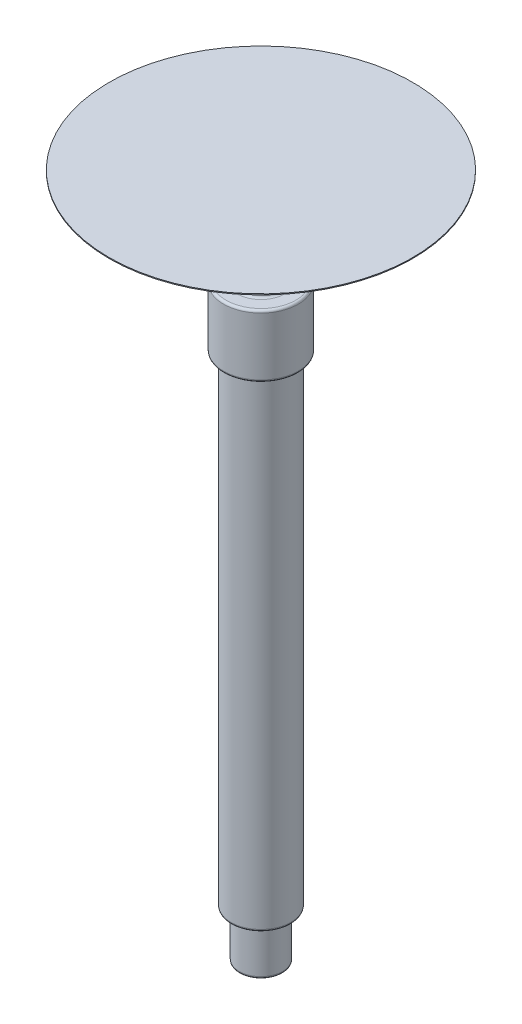
from build123d import *

# Parameters (mm, degrees)
ADAFRUIT_ALUMINUM_GT2_TIMING_PULLEY_6M_DEPTH = 7.4
BOSS_EXTRUDE7_START                          = -7.4
SKETCH3_2_R                                  = 8
BOSS_EXTRUDE7_DEPTH                          = 3
BOSS_EXTRUDE5_START                          = 3
SKETCH3_R                                    = 8
BOSS_EXTRUDE5_DEPTH                          = 3
SKETCH5_R                                    = 4.65
BOSS_EXTRUDE9_DEPTH                          = 7
BOSS_EXTRUDE10_START                         = 23.4
SKETCH3_4_R                                  = 8
BOSS_EXTRUDE10_DEPTH                         = 13.4
SKETCH1_R                                    = 6.425
BOSS_EXTRUDE1_DEPTH                          = 103
SKETCH4_R                                    = 4.65
BOSS_EXTRUDE6_DEPTH                          = 10
FILLET1_R                                    = 0.5
SKETCH6_R                                    = 32.5
BOSS_EXTRUDE11_DEPTH                         = 0.2


# Read off the part's stored shape, not the designer's step: Adafruit Aluminum GT2 Timing Pulley - 6mm Belt - 20 Tooth - 5mm Bore (Teeth Only)
with BuildPart() as part:
    # Adafruit Aluminum GT2 Timing Pulley  2 → Adafruit Aluminum GT2 Timing Pulley - 6m (new body)
    with BuildSketch(Plane(origin=(0, 0, 0), x_dir=(1, 0, 0), z_dir=(0, 1, 0))):
        with BuildLine():
            ThreePointArc((-4.171664646, 4.450529641), (-4.313351365, 4.313351365), (-4.450529641, 4.171664646))
            ThreePointArc((-4.450529641, 4.171664646), (-4.491023732, 4.064611454), (-4.444222249, 3.960161568))
            ThreePointArc((-4.444222249, 3.960161568), (-4.336160317, 3.839832706), (-4.248908631, 3.703657967))
            ThreePointArc((-4.248908631, 3.703657967), (-4.289891144, 3.116788357), (-4.835373018, 2.896458988))
            ThreePointArc((-4.835373018, 2.896458988), (-4.991845144, 2.937359964), (-5.139677666, 3.002949305))
            ThreePointArc((-5.139677666, 3.002949305), (-5.253477864, 3.01518337), (-5.342778138, 2.943589946))
            ThreePointArc((-5.342778138, 2.943589946), (-5.435139798, 2.769342049), (-5.521820486, 2.592199552))
            ThreePointArc((-5.521820486, 2.592199552), (-5.527251399, 2.477872554), (-5.450463754, 2.392997263))
            ThreePointArc((-5.450463754, 2.392997263), (-5.310507087, 2.311950687), (-5.185445494, 2.209403069))
            ThreePointArc((-5.185445494, 2.209403069), (-5.043069496, 1.638592609), (-5.493768068, 1.260483758))
            ThreePointArc((-5.493768068, 1.260483758), (-5.655221, 1.251030352), (-5.816086304, 1.26772676))
            ThreePointArc((-5.816086304, 1.26772676), (-5.928097258, 1.244195853), (-5.990903281, 1.148511157))
            ThreePointArc((-5.990903281, 1.148511157), (-6.024898878, 0.954250236), (-6.05259707, 0.758991905))
            ThreePointArc((-6.05259707, 0.758991905), (-6.02243319, 0.648582224), (-5.923175892, 0.591589713))
            ThreePointArc((-5.923175892, 0.591589713), (-5.765024422, 0.557758828), (-5.614394822, 0.498876404))
            ThreePointArc((-5.614394822, 0.498876404), (-5.30259707, 0), (-5.614394822, -0.498876404))
            ThreePointArc((-5.614394822, -0.498876404), (-5.765024422, -0.557758828), (-5.923175892, -0.591589713))
            ThreePointArc((-5.923175892, -0.591589713), (-6.02243319, -0.648582224), (-6.05259707, -0.758991905))
            ThreePointArc((-6.05259707, -0.758991905), (-6.024898878, -0.954250236), (-5.990903281, -1.148511157))
            ThreePointArc((-5.990903281, -1.148511157), (-5.928097258, -1.244195853), (-5.816086304, -1.26772676))
            ThreePointArc((-5.816086304, -1.26772676), (-5.655221, -1.251030352), (-5.493768068, -1.260483758))
            ThreePointArc((-5.493768068, -1.260483758), (-5.043069496, -1.638592609), (-5.185445494, -2.209403069))
            ThreePointArc((-5.185445494, -2.209403069), (-5.310507087, -2.311950687), (-5.450463754, -2.392997263))
            ThreePointArc((-5.450463754, -2.392997263), (-5.527251399, -2.477872554), (-5.521820486, -2.592199552))
            ThreePointArc((-5.521820486, -2.592199552), (-5.435139798, -2.769342049), (-5.342778138, -2.943589946))
            ThreePointArc((-5.342778138, -2.943589946), (-5.253477864, -3.01518337), (-5.139677666, -3.002949305))
            ThreePointArc((-5.139677666, -3.002949305), (-4.991845144, -2.937359964), (-4.835373018, -2.896458988))
            ThreePointArc((-4.835373018, -2.896458988), (-4.289891144, -3.116788357), (-4.248908631, -3.703657967))
            ThreePointArc((-4.248908631, -3.703657967), (-4.336160317, -3.839832706), (-4.444222249, -3.960161568))
            ThreePointArc((-4.444222249, -3.960161568), (-4.491023732, -4.064611454), (-4.450529641, -4.171664646))
            ThreePointArc((-4.450529641, -4.171664646), (-4.313351365, -4.313351365), (-4.171664646, -4.450529641))
            ThreePointArc((-4.171664646, -4.450529641), (-4.064611454, -4.491023732), (-3.960161568, -4.444222249))
            ThreePointArc((-3.960161568, -4.444222249), (-3.839832706, -4.336160317), (-3.703657967, -4.248908631))
            ThreePointArc((-3.703657967, -4.248908631), (-3.116788357, -4.289891144), (-2.896458988, -4.835373018))
            ThreePointArc((-2.896458988, -4.835373018), (-2.937359964, -4.991845144), (-3.002949305, -5.139677666))
            ThreePointArc((-3.002949305, -5.139677666), (-3.01518337, -5.253477864), (-2.943589946, -5.342778138))
            ThreePointArc((-2.943589946, -5.342778138), (-2.769342049, -5.435139798), (-2.592199552, -5.521820486))
            ThreePointArc((-2.592199552, -5.521820486), (-2.477872554, -5.527251399), (-2.392997263, -5.450463754))
            ThreePointArc((-2.392997263, -5.450463754), (-2.311950687, -5.310507087), (-2.209403069, -5.185445494))
            ThreePointArc((-2.209403069, -5.185445494), (-1.638592609, -5.043069496), (-1.260483758, -5.493768068))
            ThreePointArc((-1.260483758, -5.493768068), (-1.251030352, -5.655221), (-1.26772676, -5.816086304))
            ThreePointArc((-1.26772676, -5.816086304), (-1.244195853, -5.928097258), (-1.148511157, -5.990903281))
            ThreePointArc((-1.148511157, -5.990903281), (-0.954250236, -6.024898878), (-0.758991905, -6.05259707))
            ThreePointArc((-0.758991905, -6.05259707), (-0.648582224, -6.02243319), (-0.591589713, -5.923175892))
            ThreePointArc((-0.591589713, -5.923175892), (-0.557758828, -5.765024422), (-0.498876404, -5.614394822))
            ThreePointArc((-0.498876404, -5.614394822), (0, -5.30259707), (0.498876404, -5.614394822))
            ThreePointArc((0.498876404, -5.614394822), (0.557758828, -5.765024422), (0.591589713, -5.923175892))
            ThreePointArc((0.591589713, -5.923175892), (0.648582224, -6.02243319), (0.758991905, -6.05259707))
            ThreePointArc((0.758991905, -6.05259707), (0.954250236, -6.024898878), (1.148511157, -5.990903281))
            ThreePointArc((1.148511157, -5.990903281), (1.244195853, -5.928097258), (1.26772676, -5.816086304))
            ThreePointArc((1.26772676, -5.816086304), (1.251030352, -5.655221), (1.260483758, -5.493768068))
            ThreePointArc((1.260483758, -5.493768068), (1.638592609, -5.043069496), (2.209403069, -5.185445494))
            ThreePointArc((2.209403069, -5.185445494), (2.311950687, -5.310507087), (2.392997263, -5.450463754))
            ThreePointArc((2.392997263, -5.450463754), (2.477872554, -5.527251399), (2.592199552, -5.521820486))
            ThreePointArc((2.592199552, -5.521820486), (2.769342049, -5.435139798), (2.943589946, -5.342778138))
            ThreePointArc((2.943589946, -5.342778138), (3.01518337, -5.253477864), (3.002949305, -5.139677666))
            ThreePointArc((3.002949305, -5.139677666), (2.937359964, -4.991845144), (2.896458988, -4.835373018))
            ThreePointArc((2.896458988, -4.835373018), (3.116788357, -4.289891144), (3.703657967, -4.248908631))
            ThreePointArc((3.703657967, -4.248908631), (3.839832706, -4.336160317), (3.960161568, -4.444222249))
            ThreePointArc((3.960161568, -4.444222249), (4.064611454, -4.491023732), (4.171664646, -4.450529641))
            ThreePointArc((4.171664646, -4.450529641), (4.313351365, -4.313351365), (4.450529641, -4.171664646))
            ThreePointArc((4.450529641, -4.171664646), (4.491023732, -4.064611454), (4.444222249, -3.960161568))
            ThreePointArc((4.444222249, -3.960161568), (4.336160317, -3.839832706), (4.248908631, -3.703657967))
            ThreePointArc((4.248908631, -3.703657967), (4.289891144, -3.116788357), (4.835373018, -2.896458988))
            ThreePointArc((4.835373018, -2.896458988), (4.991845144, -2.937359964), (5.139677666, -3.002949305))
            ThreePointArc((5.139677666, -3.002949305), (5.253477864, -3.01518337), (5.342778138, -2.943589946))
            ThreePointArc((5.342778138, -2.943589946), (5.435139798, -2.769342049), (5.521820486, -2.592199552))
            ThreePointArc((5.521820486, -2.592199552), (5.527251399, -2.477872554), (5.450463754, -2.392997263))
            ThreePointArc((5.450463754, -2.392997263), (5.310507087, -2.311950687), (5.185445494, -2.209403069))
            ThreePointArc((5.185445494, -2.209403069), (5.043069496, -1.638592609), (5.493768068, -1.260483758))
            ThreePointArc((5.493768068, -1.260483758), (5.655221, -1.251030352), (5.816086304, -1.26772676))
            ThreePointArc((5.816086304, -1.26772676), (5.928097258, -1.244195853), (5.990903281, -1.148511157))
            ThreePointArc((5.990903281, -1.148511157), (6.024898878, -0.954250236), (6.05259707, -0.758991905))
            ThreePointArc((6.05259707, -0.758991905), (6.02243319, -0.648582224), (5.923175892, -0.591589713))
            ThreePointArc((5.923175892, -0.591589713), (5.765024422, -0.557758828), (5.614394822, -0.498876404))
            ThreePointArc((5.614394822, -0.498876404), (5.30259707, 0), (5.614394822, 0.498876404))
            ThreePointArc((5.614394822, 0.498876404), (5.765024422, 0.557758828), (5.923175892, 0.591589713))
            ThreePointArc((5.923175892, 0.591589713), (6.02243319, 0.648582224), (6.05259707, 0.758991905))
            ThreePointArc((6.05259707, 0.758991905), (6.024898878, 0.954250236), (5.990903281, 1.148511157))
            ThreePointArc((5.990903281, 1.148511157), (5.928097258, 1.244195853), (5.816086304, 1.26772676))
            ThreePointArc((5.816086304, 1.26772676), (5.655221, 1.251030352), (5.493768068, 1.260483758))
            ThreePointArc((5.493768068, 1.260483758), (5.043069496, 1.638592609), (5.185445494, 2.209403069))
            ThreePointArc((5.185445494, 2.209403069), (5.310507087, 2.311950687), (5.450463754, 2.392997263))
            ThreePointArc((5.450463754, 2.392997263), (5.527251399, 2.477872554), (5.521820486, 2.592199552))
            ThreePointArc((5.521820486, 2.592199552), (5.435139798, 2.769342049), (5.342778138, 2.943589946))
            ThreePointArc((5.342778138, 2.943589946), (5.253477864, 3.01518337), (5.139677666, 3.002949305))
            ThreePointArc((5.139677666, 3.002949305), (4.991845144, 2.937359964), (4.835373018, 2.896458988))
            ThreePointArc((4.835373018, 2.896458988), (4.289891144, 3.116788357), (4.248908631, 3.703657967))
            ThreePointArc((4.248908631, 3.703657967), (4.336160317, 3.839832706), (4.444222249, 3.960161568))
            ThreePointArc((4.444222249, 3.960161568), (4.491023732, 4.064611454), (4.450529641, 4.171664646))
            ThreePointArc((4.450529641, 4.171664646), (4.313351365, 4.313351365), (4.171664646, 4.450529641))
            ThreePointArc((4.171664646, 4.450529641), (4.064611454, 4.491023732), (3.960161568, 4.444222249))
            ThreePointArc((3.960161568, 4.444222249), (3.839832706, 4.336160317), (3.703657967, 4.248908631))
            ThreePointArc((3.703657967, 4.248908631), (3.116788357, 4.289891144), (2.896458988, 4.835373018))
            ThreePointArc((2.896458988, 4.835373018), (2.937359964, 4.991845144), (3.002949305, 5.139677666))
            ThreePointArc((3.002949305, 5.139677666), (3.01518337, 5.253477864), (2.943589946, 5.342778138))
            ThreePointArc((2.943589946, 5.342778138), (2.769342049, 5.435139798), (2.592199552, 5.521820486))
            ThreePointArc((2.592199552, 5.521820486), (2.477872554, 5.527251399), (2.392997263, 5.450463754))
            ThreePointArc((2.392997263, 5.450463754), (2.311950687, 5.310507087), (2.209403069, 5.185445494))
            ThreePointArc((2.209403069, 5.185445494), (1.638592609, 5.043069496), (1.260483758, 5.493768068))
            ThreePointArc((1.260483758, 5.493768068), (1.251030352, 5.655221), (1.26772676, 5.816086304))
            ThreePointArc((1.26772676, 5.816086304), (1.244195853, 5.928097258), (1.148511157, 5.990903281))
            ThreePointArc((1.148511157, 5.990903281), (0.954250236, 6.024898878), (0.758991905, 6.05259707))
            ThreePointArc((0.758991905, 6.05259707), (0.648582224, 6.02243319), (0.591589713, 5.923175892))
            ThreePointArc((0.591589713, 5.923175892), (0.557758828, 5.765024422), (0.498876404, 5.614394822))
            ThreePointArc((0.498876404, 5.614394822), (0, 5.30259707), (-0.498876404, 5.614394822))
            ThreePointArc((-0.498876404, 5.614394822), (-0.557758828, 5.765024422), (-0.591589713, 5.923175892))
            ThreePointArc((-0.591589713, 5.923175892), (-0.648582224, 6.02243319), (-0.758991905, 6.05259707))
            ThreePointArc((-0.758991905, 6.05259707), (-0.954250236, 6.024898878), (-1.148511157, 5.990903281))
            ThreePointArc((-1.148511157, 5.990903281), (-1.244195853, 5.928097258), (-1.26772676, 5.816086304))
            ThreePointArc((-1.26772676, 5.816086304), (-1.251030352, 5.655221), (-1.260483758, 5.493768068))
            ThreePointArc((-1.260483758, 5.493768068), (-1.638592609, 5.043069496), (-2.209403069, 5.185445494))
            ThreePointArc((-2.209403069, 5.185445494), (-2.311950687, 5.310507087), (-2.392997263, 5.450463754))
            ThreePointArc((-2.392997263, 5.450463754), (-2.477872554, 5.527251399), (-2.592199552, 5.521820486))
            ThreePointArc((-2.592199552, 5.521820486), (-2.769342049, 5.435139798), (-2.943589946, 5.342778138))
            ThreePointArc((-2.943589946, 5.342778138), (-3.01518337, 5.253477864), (-3.002949305, 5.139677666))
            ThreePointArc((-3.002949305, 5.139677666), (-2.937359964, 4.991845144), (-2.896458988, 4.835373018))
            ThreePointArc((-2.896458988, 4.835373018), (-3.116788357, 4.289891144), (-3.703657967, 4.248908631))
            ThreePointArc((-3.703657967, 4.248908631), (-3.839832706, 4.336160317), (-3.960161568, 4.444222249))
            ThreePointArc((-3.960161568, 4.444222249), (-4.064611454, 4.491023732), (-4.171664646, 4.450529641))
        make_face()
    extrude(amount=ADAFRUIT_ALUMINUM_GT2_TIMING_PULLEY_6M_DEPTH)

    # Sketch3<2> → Boss-Extrude7 (add)
    with BuildSketch(Plane.XZ.offset(BOSS_EXTRUDE7_START)):
        with Locations(Location((0, 0, 0), (0, 0, 90))):
            Circle(SKETCH3_2_R)
    extrude(amount=-BOSS_EXTRUDE7_DEPTH)

    # Sketch3 → Boss-Extrude5 (add)
    with BuildSketch(Plane.XZ.offset(BOSS_EXTRUDE5_START)):
        with Locations(Location((0, 0, 0), (0, 0, 90))):
            Circle(SKETCH3_R)
    extrude(amount=-BOSS_EXTRUDE5_DEPTH)

    # Sketch5 → Boss-Extrude9 (add)
    with BuildSketch(Plane.XZ.offset(3)):
        with Locations(Location((0, 0, 0), (0, 0, 270))):
            Circle(SKETCH5_R)
    extrude(amount=BOSS_EXTRUDE9_DEPTH)

    # Sketch3<4> → Boss-Extrude10 (add)
    with BuildSketch(Plane.XZ.offset(BOSS_EXTRUDE10_START)):
        with Locations(Location((0, 0, 0), (0, 0, 90))):
            Circle(SKETCH3_4_R)
    extrude(amount=-BOSS_EXTRUDE10_DEPTH)

    # Sketch1 → Boss-Extrude1 (add)
    with BuildSketch(Plane(origin=(0, -23.4, 0), x_dir=(1, 0, 0), z_dir=(0, 1, 0))):
        with Locations(Location((0, 0, 0), (0, 0, 90))):
            Circle(SKETCH1_R)
    extrude(amount=-BOSS_EXTRUDE1_DEPTH)

    # Sketch4 → Boss-Extrude6 (add)
    with BuildSketch(Plane.XZ.offset(126.4)):
        with Locations(Location((0, 0, 0), (0, 0, 270))):
            Circle(SKETCH4_R)
    extrude(amount=BOSS_EXTRUDE6_DEPTH)

    # Fillet1
    fillet1_edges = [part.edges().sort_by_distance(p)[0] for p in [
        (-0.557758828, 0, -5.765024422),
        (-0.557758828, 7.4, -5.765024422),
        (-0.648582224, 0, -6.02243319),
        (-0.648582224, 7.4, -6.02243319),
        (0, 7.4, -5.30259707),
        (0.557758828, 7.4, -5.765024422),
        (0.648582224, 7.4, -6.02243319),
        (0, 0, -5.30259707),
        (0.648582224, 0, -6.02243319),
        (0.557758828, 0, -5.765024422),
        (-3.839832706, 0, -4.336160317),
        (-3.839832706, 7.4, -4.336160317),
        (-4.064611454, 0, -4.491023732),
        (-4.064611454, 7.4, -4.491023732),
        (-3.116788357, 7.4, -4.289891144),
        (-2.937359964, 7.4, -4.991845144),
        (-3.01518337, 7.4, -5.253477864),
        (-3.116788357, 0, -4.289891144),
        (-3.01518337, 0, -5.253477864),
        (-2.937359964, 0, -4.991845144),
        (-4.991845144, 0, -2.937359964),
        (-4.991845144, 7.4, -2.937359964),
        (-5.253477864, 0, -3.01518337),
        (-5.253477864, 7.4, -3.01518337),
        (-4.289891144, 7.4, -3.116788357),
        (-4.336160317, 7.4, -3.839832706),
        (-4.491023732, 7.4, -4.064611454),
        (-4.289891144, 0, -3.116788357),
        (-4.491023732, 0, -4.064611454),
        (-4.336160317, 0, -3.839832706),
        (-5.655221, 0, -1.251030352),
        (-5.655221, 7.4, -1.251030352),
        (-5.928097258, 0, -1.244195853),
        (-5.928097258, 7.4, -1.244195853),
        (-5.043069496, 7.4, -1.638592609),
        (-5.310507087, 7.4, -2.311950687),
        (-5.527251399, 7.4, -2.477872554),
        (-5.043069496, 0, -1.638592609),
        (-5.527251399, 0, -2.477872554),
        (-5.310507087, 0, -2.311950687),
        (-5.765024422, 0, 0.557758828),
        (-5.765024422, 7.4, 0.557758828),
        (-6.02243319, 0, 0.648582224),
        (-6.02243319, 7.4, 0.648582224),
        (-5.30259707, 7.4, 0),
        (-5.765024422, 7.4, -0.557758828),
        (-6.02243319, 7.4, -0.648582224),
        (-5.30259707, 0, 0),
        (-6.02243319, 0, -0.648582224),
        (-5.765024422, 0, -0.557758828),
        (-5.310507087, 0, 2.311950687),
        (-5.310507087, 7.4, 2.311950687),
        (-5.527251399, 0, 2.477872554),
        (-5.527251399, 7.4, 2.477872554),
        (-5.043069496, 7.4, 1.638592609),
        (-5.655221, 7.4, 1.251030352),
        (-5.928097258, 7.4, 1.244195853),
        (-5.043069496, 0, 1.638592609),
        (-5.928097258, 0, 1.244195853),
        (-5.655221, 0, 1.251030352),
        (-4.336160317, 0, 3.839832706),
        (-4.336160317, 7.4, 3.839832706),
        (-4.491023732, 0, 4.064611454),
        (-4.491023732, 7.4, 4.064611454),
        (-4.289891144, 7.4, 3.116788357),
        (-4.991845144, 7.4, 2.937359964),
        (-5.253477864, 7.4, 3.01518337),
        (-4.289891144, 0, 3.116788357),
        (-5.253477864, 0, 3.01518337),
        (-4.991845144, 0, 2.937359964),
        (-2.937359964, 0, 4.991845144),
        (-2.937359964, 7.4, 4.991845144),
        (-3.01518337, 0, 5.253477864),
        (-3.01518337, 7.4, 5.253477864),
        (-3.116788357, 7.4, 4.289891144),
        (-3.839832706, 7.4, 4.336160317),
        (-4.064611454, 7.4, 4.491023732),
        (-3.116788357, 0, 4.289891144),
        (-4.064611454, 0, 4.491023732),
        (-3.839832706, 0, 4.336160317),
        (-1.251030352, 0, 5.655221),
        (-1.251030352, 7.4, 5.655221),
        (-1.244195853, 0, 5.928097258),
        (-1.244195853, 7.4, 5.928097258),
        (-1.638592609, 7.4, 5.043069496),
        (-2.311950687, 7.4, 5.310507087),
        (-2.477872554, 7.4, 5.527251399),
        (-1.638592609, 0, 5.043069496),
        (-2.477872554, 0, 5.527251399),
        (-2.311950687, 0, 5.310507087),
        (0.557758828, 0, 5.765024422),
        (0.557758828, 7.4, 5.765024422),
        (0.648582224, 0, 6.02243319),
        (0.648582224, 7.4, 6.02243319),
        (0, 7.4, 5.30259707),
        (-0.557758828, 7.4, 5.765024422),
        (-0.648582224, 7.4, 6.02243319),
        (0, 0, 5.30259707),
        (-0.648582224, 0, 6.02243319),
        (-0.557758828, 0, 5.765024422),
        (2.311950687, 0, 5.310507087),
        (2.311950687, 7.4, 5.310507087),
        (2.477872554, 0, 5.527251399),
        (2.477872554, 7.4, 5.527251399),
        (1.638592609, 7.4, 5.043069496),
        (1.251030352, 7.4, 5.655221),
        (1.244195853, 7.4, 5.928097258),
        (1.638592609, 0, 5.043069496),
        (1.244195853, 0, 5.928097258),
        (1.251030352, 0, 5.655221),
        (3.839832706, 0, 4.336160317),
        (3.839832706, 7.4, 4.336160317),
        (4.064611454, 0, 4.491023732),
        (4.064611454, 7.4, 4.491023732),
        (3.116788357, 7.4, 4.289891144),
        (2.937359964, 7.4, 4.991845144),
        (3.01518337, 7.4, 5.253477864),
        (3.116788357, 0, 4.289891144),
        (3.01518337, 0, 5.253477864),
        (2.937359964, 0, 4.991845144),
        (4.991845144, 0, 2.937359964),
        (4.991845144, 7.4, 2.937359964),
        (5.253477864, 0, 3.01518337),
        (5.253477864, 7.4, 3.01518337),
        (4.289891144, 7.4, 3.116788357),
        (4.336160317, 7.4, 3.839832706),
        (4.491023732, 7.4, 4.064611454),
        (4.289891144, 0, 3.116788357),
        (4.491023732, 0, 4.064611454),
        (4.336160317, 0, 3.839832706),
        (5.655221, 0, 1.251030352),
        (5.655221, 7.4, 1.251030352),
        (5.928097258, 0, 1.244195853),
        (5.928097258, 7.4, 1.244195853),
        (5.043069496, 7.4, 1.638592609),
        (5.310507087, 7.4, 2.311950687),
        (5.527251399, 7.4, 2.477872554),
        (5.043069496, 0, 1.638592609),
        (5.527251399, 0, 2.477872554),
        (5.310507087, 0, 2.311950687),
        (5.765024422, 0, -0.557758828),
        (5.765024422, 7.4, -0.557758828),
        (6.02243319, 0, -0.648582224),
        (6.02243319, 7.4, -0.648582224),
        (5.30259707, 7.4, 0),
        (5.765024422, 7.4, 0.557758828),
        (6.02243319, 7.4, 0.648582224),
        (5.30259707, 0, 0),
        (6.02243319, 0, 0.648582224),
        (5.765024422, 0, 0.557758828),
        (5.310507087, 0, -2.311950687),
        (5.310507087, 7.4, -2.311950687),
        (5.527251399, 0, -2.477872554),
        (5.527251399, 7.4, -2.477872554),
        (5.043069496, 7.4, -1.638592609),
        (5.655221, 7.4, -1.251030352),
        (-2.769342049, 0, -5.435139798),
        (5.928097258, 7.4, -1.244195853),
        (5.043069496, 0, -1.638592609),
        (5.928097258, 0, -1.244195853),
        (5.655221, 0, -1.251030352),
        (-4.313351365, 0, -4.313351365),
        (4.336160317, 0, -3.839832706),
        (4.336160317, 7.4, -3.839832706),
        (4.491023732, 0, -4.064611454),
        (4.491023732, 7.4, -4.064611454),
        (4.289891144, 7.4, -3.116788357),
        (4.991845144, 7.4, -2.937359964),
        (5.253477864, 7.4, -3.01518337),
        (4.289891144, 0, -3.116788357),
        (5.253477864, 0, -3.01518337),
        (4.991845144, 0, -2.937359964),
        (-5.435139798, 0, -2.769342049),
        (2.937359964, 0, -4.991845144),
        (2.937359964, 7.4, -4.991845144),
        (3.01518337, 0, -5.253477864),
        (3.01518337, 7.4, -5.253477864),
        (3.116788357, 7.4, -4.289891144),
        (3.839832706, 7.4, -4.336160317),
        (4.064611454, 7.4, -4.491023732),
        (3.116788357, 0, -4.289891144),
        (4.064611454, 0, -4.491023732),
        (3.839832706, 0, -4.336160317),
        (-6.024898878, 0, -0.954250236),
        (1.251030352, 0, -5.655221),
        (1.251030352, 7.4, -5.655221),
        (1.244195853, 0, -5.928097258),
        (1.244195853, 7.4, -5.928097258),
        (1.638592609, 7.4, -5.043069496),
        (2.311950687, 7.4, -5.310507087),
        (2.477872554, 7.4, -5.527251399),
        (-6.024898878, 0, 0.954250236),
        (1.638592609, 0, -5.043069496),
        (2.477872554, 0, -5.527251399),
        (2.311950687, 0, -5.310507087),
        (-2.311950687, 0, -5.310507087),
        (-5.435139798, 0, 2.769342049),
        (-2.311950687, 7.4, -5.310507087),
        (-2.477872554, 0, -5.527251399),
        (-2.477872554, 7.4, -5.527251399),
        (-1.638592609, 7.4, -5.043069496),
        (-1.251030352, 7.4, -5.655221),
        (-1.244195853, 7.4, -5.928097258),
        (-1.638592609, 0, -5.043069496),
        (-1.244195853, 0, -5.928097258),
        (-1.251030352, 0, -5.655221),
        (-4.313351365, 0, 4.313351365),
        (-2.769342049, 0, 5.435139798),
        (-0.954250236, 0, 6.024898878),
        (0.954250236, 0, 6.024898878),
        (2.769342049, 0, 5.435139798),
        (4.313351365, 0, 4.313351365),
        (5.435139798, 0, 2.769342049),
        (6.024898878, 0, 0.954250236),
        (6.024898878, 0, -0.954250236),
        (5.435139798, 0, -2.769342049),
        (4.313351365, 0, -4.313351365),
        (2.769342049, 0, -5.435139798),
        (0.954250236, 0, -6.024898878),
        (0, 7.4, -8),
        (0, 10.4, -8),
        (0, 0, -8),
        (0, -3, -8),
        (-0.954250236, 0, -6.024898878),
        (0, -3, 4.65),
        (0, -10, 4.65),
        (0, -10, -8),
        (0, -23.4, -8),
        (0, -126.4, 6.425),
        (0, -23.4, 6.425),
        (0, -126.4, 4.65),
        (0, -136.4, 4.65),
        (-2.769342049, 7.4, -5.435139798),
        (-4.313351365, 7.4, -4.313351365),
        (-5.435139798, 7.4, -2.769342049),
        (-6.024898878, 7.4, -0.954250236),
        (-6.024898878, 7.4, 0.954250236),
        (-5.435139798, 7.4, 2.769342049),
        (-4.313351365, 7.4, 4.313351365),
        (-2.769342049, 7.4, 5.435139798),
        (-0.954250236, 7.4, 6.024898878),
        (0.954250236, 7.4, 6.024898878),
        (2.769342049, 7.4, 5.435139798),
        (4.313351365, 7.4, 4.313351365),
        (5.435139798, 7.4, 2.769342049),
        (-0.954250236, 7.4, -6.024898878),
        (6.024898878, 7.4, 0.954250236),
        (6.024898878, 7.4, -0.954250236),
        (5.435139798, 7.4, -2.769342049),
        (4.313351365, 7.4, -4.313351365),
        (2.769342049, 7.4, -5.435139798),
        (0.954250236, 7.4, -6.024898878),
    ]]
    fillet(fillet1_edges, radius=FILLET1_R)

    # Sketch6 → Boss-Extrude11 (add)
    with BuildSketch(Plane(origin=(0, 10.4, 0), x_dir=(1, 0, 0), z_dir=(0, 1, 0))):
        with Locations(Location((0, 0, 0), (0, 0, 270))):
            Circle(SKETCH6_R)
    extrude(amount=-BOSS_EXTRUDE11_DEPTH)


solid = part.part
